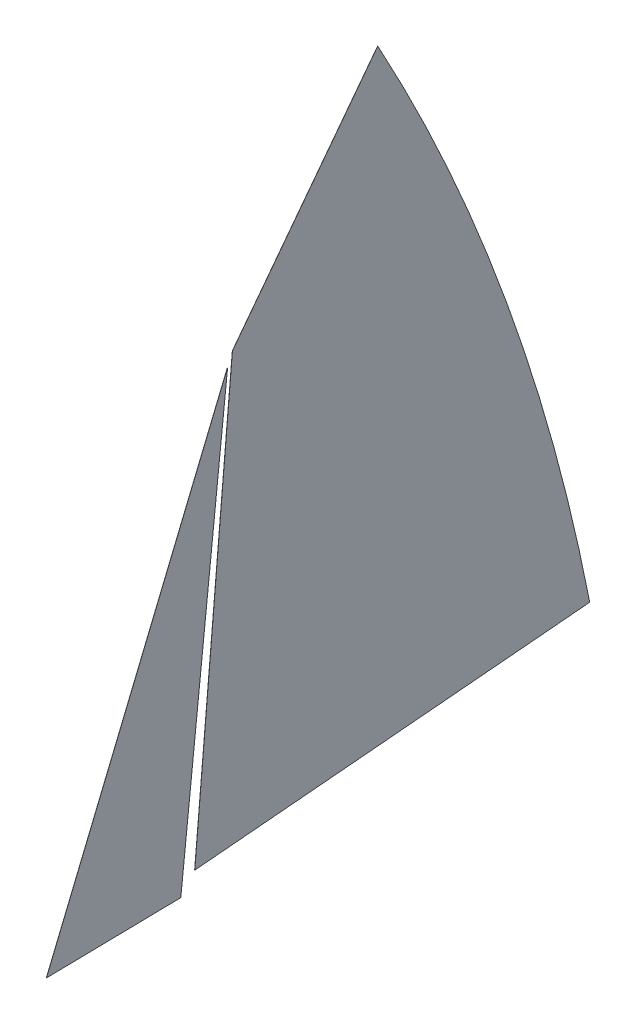
from build123d import *

# Parameters (mm, degrees)
EXTRUDE_1_DEPTH   = 1
EXTRUDE_1_2_DEPTH = 1


with BuildPart() as part:
    # Бобышка-Вытянуть1: read off the stored shape, not the designer's step
    # Бобышка-Вытянуть1 outline → Бобышка-Вытянуть1 (new body)
    with BuildSketch(Plane(origin=(0, 0, 0), x_dir=(0, 0, -1), z_dir=(1, 0, 0))):
        Polygon((282.799157333, 1062.380398351), (1401.353661487, 1082.415636928), (1791.111927582, 4711.752688983), align=None)
    extrude(amount=EXTRUDE_1_DEPTH)


with BuildPart() as body_2:
    # Extrude 1 2 outline → Extrude 1 2 (new body)
    with BuildSketch(Plane(origin=(0, 0, 0), x_dir=(0, 0, -1), z_dir=(1, 0, 0))):
        with BuildLine():
            Line((1831.191822441, 4808.726248177), (1517.43114855, 1222.425335046))
            Line((1517.43114855, 1222.425335046), (4804.873652252, 1510.039286114))
            ThreePointArc((4804.873652252, 1510.039286114), (4110.887221115, 4023.678646364), (3040.626375246, 6401.606677613))
            Line((3040.626375246, 6401.606677613), (1831.191822441, 4808.726248177))
        make_face()
    extrude(amount=EXTRUDE_1_2_DEPTH)


solid = Compound([part.part, body_2.part])
